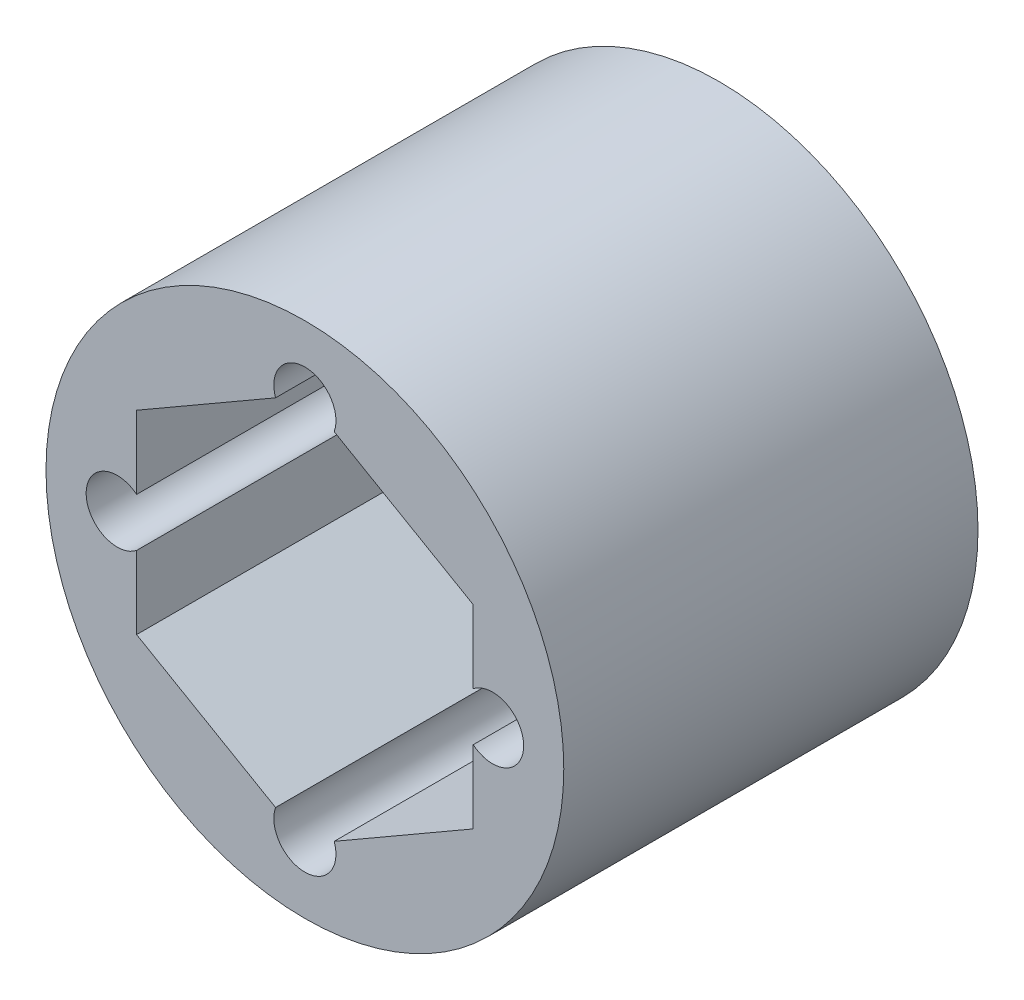
from build123d import *

# Parameters (mm, degrees)
SKETCH1_R           = 10
SKETCH1_R_2         = 1.2
SKETCH1_R_3         = 4.25
BOSS_EXTRUDE1_DEPTH = 16
CUT_EXTRUDE1_DEPTH  = 14


with BuildPart() as part:
    # Sketch1 → Boss-Extrude1 (new body)
    with BuildSketch(Plane.XY):
        Circle(SKETCH1_R)
        with Locations((0, 7.25)):
            Circle(SKETCH1_R_2, mode=Mode.SUBTRACT)
        Circle(SKETCH1_R_3, mode=Mode.SUBTRACT)
        with Locations((7.25, 0)):
            Circle(SKETCH1_R_2, mode=Mode.SUBTRACT)
        with Locations((0, -7.25)):
            Circle(SKETCH1_R_2, mode=Mode.SUBTRACT)
        with Locations((-7.25, 0)):
            Circle(SKETCH1_R_2, mode=Mode.SUBTRACT)
    extrude(amount=BOSS_EXTRUDE1_DEPTH)

    # Sketch2 → Cut-Extrude1 (cut)
    with BuildSketch(Plane.XY.offset(16)):
        Polygon((0, 7.505553499), (-6.5, 3.75277675), (-6.5, -3.75277675), (0, -7.505553499), (6.5, -3.75277675), (6.5, 3.75277675), align=None)
    extrude(amount=-CUT_EXTRUDE1_DEPTH, mode=Mode.SUBTRACT)


solid = part.part
